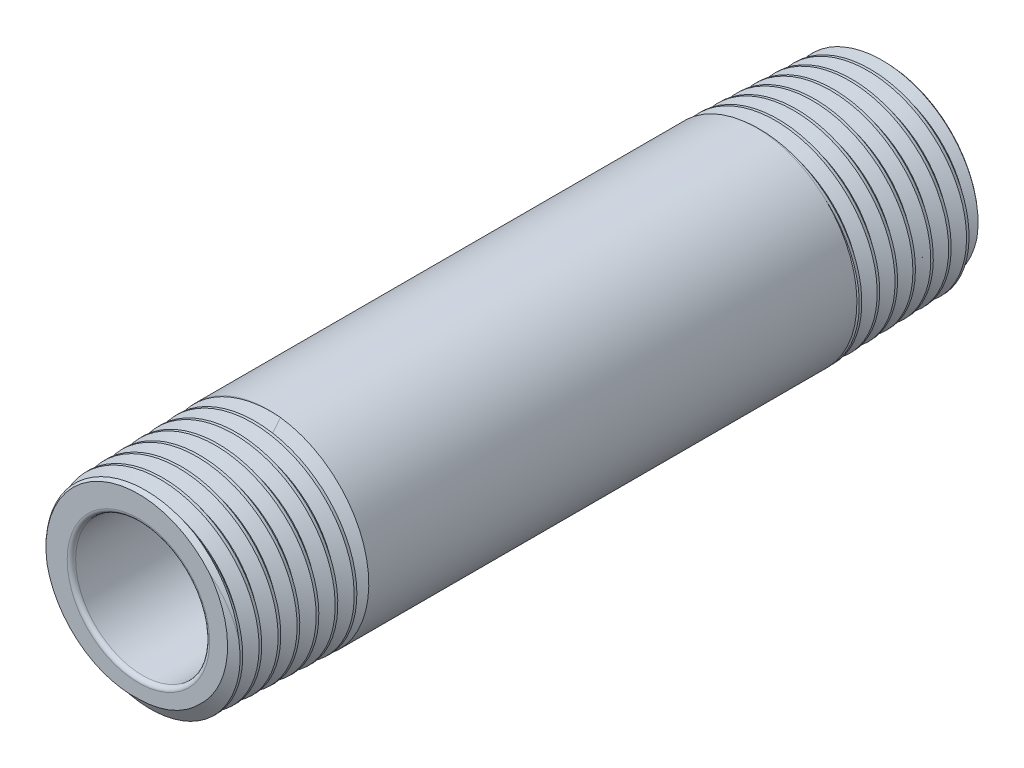
from build123d import *

# Parameters (mm, degrees)
CHAMFER1_SIZE       = 0.2159
CHAMFER1_SIZE2      = 0.22294606732244152
FILLET1_R           = 0.2159
SKETCH6_R           = 5.143500000000003
BOSS_EXTRUDE1_DEPTH = 6.604
BOSS_EXTRUDE1_TAPER = 60.000000000000135
SKETCH7_R           = 3.416299999999999
CUT_EXTRUDE1_DEPTH  = 21.39151025224469
CIRPATTERN1_COUNT   = 2


with BuildPart() as part:
    # Sketch3 → Revolve1 (revolve)
    with BuildSketch(Plane(origin=(0, 0, 0), x_dir=(0, 0, -1), z_dir=(1, 0, 0)), mode=Mode.PRIVATE) as revolve1_sk:
        Polygon((-19.049999999999997, 4.937883844480303), (-12.445999999999998, 5.143500000000026), (0, 5.143500000000033), (0, 3.416299999999999), (-19.049999999999997, 3.4162999999999966), align=None)
    revolve(revolve1_sk.sketch.rotate(Axis((0, 2.566e-14, 19.049999999999997), (0, 0, -1)), 90), axis=Axis((0, 2.566e-14, 19.049999999999997), (0, 0, -1)))

    # Chamfer1
    chamfer1_edges = [part.edges().sort_by_distance(p)[0] for p in [
        (-4.937883844480277, 2.451e-14, 19.049999999999997),
    ]]
    chamfer1_side = [part.faces().sort_by_distance(p)[0] for p in [
        (-5.040691922240139, 2.449e-14, 15.747999999999998),
    ]]
    chamfer(chamfer1_edges, length=CHAMFER1_SIZE, length2=CHAMFER1_SIZE2, reference=chamfer1_side[0])

    # Fillet1
    fillet1_edges = [part.edges().sort_by_distance(p)[0] for p in [
        (-3.416299999999971, 2.486e-14, 19.049999999999997),
    ]]
    fillet(fillet1_edges, radius=FILLET1_R)

    # Mirror1: part across plane


with BuildPart() as part_1:
    add(part.part)
    add(part.part.mirror(Plane.XY))

    # SurfaceCut1
    split(bisect_by=Plane.XY, keep=Keep.TOP)


with BuildPart() as body_2:
    # Split1: the piece on the far side of the plane
    add(part_1.part)
    split(bisect_by=Plane.XY.offset(12.445999999999998), keep=Keep.BOTTOM)


with BuildPart() as part_2:
    add(part_1.part)

    # Split1
    split(bisect_by=Plane.XY.offset(12.445999999999998), keep=Keep.TOP)

    # Cut-Sweep1: sweep along a curve in space
    with BuildLine() as cut_sweep1_path:
        add(Edge.make_bspline(
            [(-1.724e-14, 4.937883844480297, 19.049999999999997), (0.6479834024634948, 4.9384955793921845, 19.030352237654323), (1.2959562068442978, 4.809934846285584, 19.01070447530864), (2.493700065543902, 4.3137597166585575, 18.971408950617278), (3.042994402756142, 3.946340706793448, 18.951761188271604), (3.9591268792347645, 3.028337158977756, 18.912465663580246), (4.325599581977704, 2.4781160609167507, 18.892817901234565), (4.819696815521148, 1.2784716410989483, 18.853522376543214), (4.947123203730261, 0.6295243122559492, 18.833874614197534), (4.943249861633712, -0.6683639161122303, 18.794579089506172), (4.811949732972757, -1.3167890375944493, 18.774931327160495), (4.310328895597964, -2.514351520947074, 18.73563580246913), (3.940205740552795, -3.063012230766883, 18.715988040123456), (3.0172413047935445, -3.9768869433170755, 18.676692515432094), (2.464765440787788, -4.34173640138223, 18.657044753086417), (1.261404965161384, -4.8318438829556705, 18.617749228395066), (0.6109978302294494, -4.956905346490915, 18.59810146604938), (-0.688791747116143, -4.947920120672505, 18.55880594135802), (-1.3376576482970945, -4.813875064430212, 18.539158179012347), (-2.535014429222804, -4.3068023036928365, 18.49986265432099), (-3.083028731651889, -3.93397432237736, 18.480214891975308), (-3.9946208246623853, -3.006052595447282, 18.44091936728395), (-4.3578349723354535, -2.4513262419514277, 18.42127160493827), (-4.843931124589415, -1.2442625734004324, 18.38197608024691), (-4.9666181604179656, -0.5924042137085583, 18.362328317901234), (-4.952506058257749, 0.7092665494087685, 18.323032793209872), (-4.8157105908348266, 1.3585616564247005, 18.303385030864195), (-4.303179798311932, 2.5556883562747204, 18.26408950617284), (-3.927646368357448, 3.1030434562276152, 18.24444174382716), (-2.9947710658231097, 4.0123280676016995, 18.205146219135795), (-2.4377985593168003, 4.373894847772765, 18.18549845679012), (-1.2270446729304163, 4.855958132963638, 18.14620293209877), (-0.5737437219430983, 4.976261269038454, 18.126555169753082), (0.7297879753111253, 4.95700737756262, 18.087259645061724), (1.379500678039882, 4.817456063988477, 18.067611882716047), (2.576372867063742, 4.299461238757999, 18.028316358024693), (3.123055954632113, 3.9212217966252103, 18.008668595679012), (4.030008216337635, 2.9833967529530843, 17.969373070987654), (4.389915580786658, 2.4241824899391498, 17.949725308641973), (4.867924501325379, 1.2097514728986394, 17.910429783950622), (4.985834296848172, 0.5550166161046024, 17.890782021604934), (4.961423783192364, -0.7503556755375738, 17.851486496913576), (4.8191112373252585, -1.400474327802263, 17.831838734567903), (4.2956464862729735, -2.59706752561658, 17.792543209876545), (3.9147005273586846, -3.1430657763341334, 17.772895447530864), (2.971929696018746, -4.047660814954261, 17.733599922839506), (2.410478133020024, -4.405896724636701, 17.713952160493825), (1.1923831844830064, -4.879829823637146, 17.67465663580247), (0.5362231592826996, -4.9953368693209494, 17.655008873456786), (-0.7709692992017093, -4.965754981192314, 17.61571334876543), (-1.42148221897539, -4.820675865918678, 17.596065586419755), (-2.61777189503427, -4.2917354040431475, 17.556770061728393), (-3.1630724701423, -3.9080824827857614, 17.537122299382716), (-4.065285407426989, -2.960369936352574, 17.49782677469135), (-4.421837832759499, -2.3966855899074933, 17.478179012345677), (-4.89167369458659, -1.1749400208896585, 17.438883487654323), (-5.00476861291793, -0.5173636164814726, 17.41923572530864), (-4.970000679055924, 0.7916284938222706, 17.37994020061728), (-4.82214970648881, 1.4425239634336553, 17.360292438271607), (-4.287727857204288, 2.638485537500708, 17.320996913580245), (-3.9013675871881586, 3.1830755842142184, 17.301349151234568), (-2.9487175174394733, 4.082881537632398, 17.262053626543203), (-2.3828049640962297, 4.437738458778683, 17.242405864197526), (-1.1574221973504755, 4.9034557095961935, 17.20311033950618), (-0.49843825461570823, 5.014129155096828, 17.18346257716049), (0.8123329053291589, 4.974160585732752, 17.144167052469136), (1.4635991716692796, 4.823532517409431, 17.124519290123455), (2.659208014291241, 4.283623712846748, 17.0852237654321), (3.2030746660656804, 3.894555766905329, 17.06557600308642), (4.100448749358127, 2.9369724849181824, 17.026280478395062), (4.453598156514858, 2.368836361227666, 17.00663271604938), (4.915175464832906, 1.1398299311206526, 16.96733719135803), (5.023418124321186, 0.4794473425072056, 16.94768942901235), (4.978234411636441, -0.833082178069387, 16.908393904320985), (4.824824058715115, -1.484707452799352, 16.88874614197531), (4.279422840020476, -2.679938885781295, 16.849450617283946), (3.887646950338295, -3.22306926257988, 16.829802854938272), (2.9251348865825912, -4.1179865863127825, 16.79050733024691), (2.354779889089959, -4.469416479995621, 16.770859567901233), (1.1221634414760926, -4.926832557217814, 16.731564043209882), (0.4603911508809596, -5.0326351500695905, 16.711916280864195), (-0.853875954813153, -4.982221868652633, 16.672620756172844), (-1.5058484145728106, -4.826024092108318, 16.652972993827163), (-2.7006777114549543, -4.2751251097400855, 16.613677469135798), (-3.2430589200165834, -3.88064106795353, 16.594029706790124), (-4.135494592135794, -2.9132047723831316, 16.554734182098766), (-4.4851929834655, -2.3406356576180656, 16.535086419753085), (-4.938426584435778, -1.1044229497109015, 16.495790895061734), (-5.041779862844908, -0.4412699523613095, 16.47614313271605), (-4.986122670146919, 0.8747138767599391, 16.436847608024692), (-4.827132380966399, 1.5270216633776004, 16.417199845679015), (-4.270730394989775, 2.721424049913686, 16.37790432098765), (-3.873538052286691, 3.263043184021431, 16.358256558641976), (-2.901182194427972, 4.1529723104073675, 16.318961033950615), (-2.3264037788936145, 4.50092722139599, 16.299313271604937), (-1.0866086791346827, 4.949957144945079, 16.260017746913583), (-0.4220840214680713, 5.0508518941834835, 16.2403699845679), (0.895595583544624, 4.989936530972702, 16.20107445987654), (1.548226804247682, 4.828148690348668, 16.181426697530863), (2.742177458884932, 4.266238570728335, 16.142131172839505), (3.283021599635118, 3.866337837946425, 16.122483410493825), (4.170419284658331, 2.8890672069843424, 16.083187885802463), (4.516618748495482, 2.31208436714491, 16.06354012345679), (4.96142383798703, 1.0687208550699734, 16.024244598765435), (5.059850876664323, 0.4028336346126808, 16.00459683641975), (4.993663167479094, -0.9165207132435833, 15.965301311728398), (4.829072787003335, -1.5694634408702866, 15.945653549382717), (4.261649513893983, -2.762937495230911, 15.906358024691352), (3.8590403616180198, -3.3029937113027605, 15.886710262345678), (2.876859866479624, -4.187835058380133, 15.84741473765432), (2.2976775387466932, -4.532267119719317, 15.82776697530864), (1.050759704849418, -4.972826263595607, 15.788471450617289), (0.38351907009412417, -5.068776443918274, 15.768823688271604), (-0.9374889023809881, -4.997302297518728, 15.72952816358025), (-1.5907311755930338, -4.829904439374469, 15.70988040123457), (-2.7837037149572947, -4.256963103409261, 15.670584876543211), (-3.32295906288315, -3.851645562067084, 15.65093711419753), (-4.2052191750347285, -2.864560231502529, 15.611641589506174), (-4.547871890279748, -2.2831834122200023, 15.591993827160492), (-4.984164022607058, -1.0327254578130656, 15.552698302469135), (-5.077628230637193, -0.36414060809498533, 15.533050540123455), (-5.000853640455587, 0.9584997859349876, 15.493755015432098), (-4.830643417608928, 1.612029609431176, 15.474107253086416), (-4.252179220185848, 2.804475673221989, 15.43481172839506), (-3.8441533801432164, 3.3429171976580383, 15.41516396604938), (-2.85216836280425, 4.222571178064509, 15.375868441358021), (-2.2686021082319927, 4.563432615655921, 15.356220679012344), (-1.014618345305617, 4.995436716669484, 15.316925154320984), (-0.344698530677452, 5.0864058725830725, 15.297277391975308), (0.9795529973439306, 5.004316917172806, 15.25798186728395), (1.6333583420747773, 4.831289493563263, 15.23833410493827), (2.825252924343863, 4.247297747129387, 15.199038580246917), (3.3628676583415515, 3.836563758783516, 15.179390817901234), (4.239890610902287, 2.8396843232994136, 15.140095293209875), (4.578948851603917, 2.253933749595567, 15.1204475308642), (5.006643948252462, 0.9964386006734746, 15.08115200617284), (5.095109006597185, 0.32519312177911697, 15.06150424382716), (5.0076918500804135, -1.0006481685127746, 15.022208719135802), (4.831842440810549, -1.6547169718960992, 15.002560956790125), (4.242318569144174, -2.846035021811639, 14.963265432098767), (3.828876643016173, -3.3828099870895003, 14.943617669753086), (2.827108178067148, -4.257177016981221, 14.904322145061727), (2.2391784612691006, -4.594420154166729, 14.88467438271605), (0.9781864592619042, -5.017785320656595, 14.845378858024691), (0.30562466720889814, -5.10373727060919, 14.82573109567901), (-1.0217849298193837, -5.010978163123082, 14.786435570987651), (-1.6761050959568649, -4.832302034647226, 14.766787808641974), (-2.8668215182926757, -4.237241573137894, 14.72749228395062), (-3.4027437255087736, -3.8210919799639425, 14.707844521604937), (-4.2744299397448104, -2.8144399943520226, 14.66854899691358), (-4.609846079684246, -2.2243363703561254, 14.648901234567901), (-5.028860438023093, -0.9598621584121545, 14.609605709876544), (-5.112290303646229, -0.28599345464291737, 14.589957947530861), (-5.014175581787844, 1.0429629101208588, 14.550662422839505), (-4.8326680520999235, 1.6975223100155539, 14.53101466049383), (-4.232066648026328, 2.887611965641789, 14.491719135802471), (-3.8132097188476517, 3.4226684146666897, 14.472071373456785), (-2.801679841565012, 4.2916489226568, 14.432775848765429), (-2.2094076061048256, 4.625226184803297, 14.413128086419752), (-0.9414659374583672, 5.039868905343335, 14.373832561728396), (-0.2662997736201707, 5.120767745842014, 14.354184799382711), (1.0641817367600617, 5.017283833111765, 14.314889274691357), (1.7189682085348887, 4.832940271932183, 14.29524151234568), (2.908405914910209, 4.2267936847379275, 14.25594598765432), (3.4425835951004813, 3.805229810989547, 14.236298225308637), (4.308833509211241, 2.78882779128429, 14.197002700617285), (4.6405600264876385, 2.1943922999076197, 14.177354938271607), (5.050810328468426, 0.92299803772461, 14.138059413580248), (5.1291692384458845, 0.24654391553834132, 14.118411651234565), (5.020302645689612, -1.0854410355720012, 14.079116126543209), (4.833118474651225, -1.740442384689195, 14.05946836419753), (4.2214225762184325, -2.9292029163544435, 14.02017283950617), (3.7971522098167183, -3.4624888068266872, 14.000525077160491), (2.7758839172561105, -4.325983242942424, 13.961229552469131), (2.179290585300722, -4.6558471620279365, 13.941581790123458), (0.9044587025218613, -5.061684314118704, 13.9022862654321), (0.2267261736494774, -5.137494423831862, 13.882638503086417), (-1.1067404308903488, -5.023231749681475, 13.843342978395059), (-1.7619444303718013, -4.833202442514659, 13.823695216049384), (-2.950002519445155, -4.2159532174354695, 13.784399691358024), (-3.4823835893506296, -3.788976870864395, 13.764751929012343), (-4.3430976674349, -2.7628482953955387, 13.725456404320985), (-4.6710871490518215, -2.1641025979634794, 13.70580864197531), (-5.072490469893311, -0.8858481771447881, 13.66651311728395), (-5.145742945507685, -0.20684684305560724, 13.646865354938269), (-5.026070876820374, 1.1280795455540011, 13.607569830246911), (-4.833191959537128, 1.783473936202618, 13.587922067901236), (-4.210385505382988, 2.9708042728762063, 13.54862654320988), (-3.780703751779336, 3.502267481675788, 13.528978780864197), (-2.7497210037873256, 4.360176326333416, 13.489683256172842), (-2.14882847571786, 4.686279545533863, 13.470035493827162), (-0.8671667088686656, 5.083228404279672, 13.430739969135804), (-0.1869062207044988, 5.1539144481238095, 13.411092206790121), (1.149458000913506, 5.028819760419864, 13.371796682098765), (1.8050304915355837, 4.833086811496976, 13.352148919753088), (2.9916077245735675, 4.204719339085805, 13.31285339506173), (3.5221400223134385, 3.7723328123229334, 13.293205632716049), (4.377218763353007, 2.7365021226864017, 13.253910108024685), (4.701423909805591, 2.133468358527786, 13.234262345679014), (5.093897726663025, 0.8484145469461539, 13.194966820987656), (5.162008577482427, 0.16690460538500904, 13.175319058641975), (5.031478135381537, -1.1708754168378805, 13.136023533950617), (4.832886785942842, -1.8266136844662277, 13.11637577160494), (4.198954619604006, -3.0124124217043278, 13.077080246913582), (3.7638640143745232, -3.542000749292053, 13.0574324845679), (2.723191734518647, -4.394224522288958, 13.018136959876543), (2.1180223884984217, -4.716519800565512, 12.998489197530866), (0.8295919426040201, -5.104498047335914, 12.959193672839508), (0.14684229772275564, -5.170024980546429, 12.939545910493827), (-1.192331411721108, -5.03404573820258, 12.900250385802469), (-1.8482231018392825, -4.832591672200238, 12.880602623456788), (-3.0332179106857495, -4.193091250037344, 12.841307098765435), (-3.561849200166853, -3.7552973219345183, 12.821659336419753), (-4.411193147026837, -2.709789923881475, 12.782363811728395), (-4.731566776889069, -2.102490709875576, 12.762716049382716), (-5.115028977507638, -0.8106991490399917, 12.72342052469136), (-5.177963305448383, -0.12671960017556644, 12.703772762345679), (-5.036522306983252, 1.2138256024888492, 12.664477237654319), (-4.832201261378136, 1.8698583292561528, 12.644829475308642), (-4.187129135529673, 3.0540237371941865, 12.605533950617286), (-3.7466327011275444, 3.5816849120293432, 12.585886188271605), (-2.6962967775443714, 4.428124181552494, 12.546590663580243), (-2.0868734690447273, 4.746564398238731, 12.526942901234566), (-0.7917364214192102, 5.12549012931377, 12.487647376543212), (-0.10653681702892127, 5.185823201499467, 12.467999614197531), (1.2353576046051575, 5.03890758143436, 12.428704089506173), (1.8915189510827712, 4.831715346375406, 12.409056327160494), (3.074829446174329, 4.1810681832731476, 12.369760802469136), (3.6015074215168745, 3.7378701202055127, 12.350113040123457), (4.445017169962126, 2.682712384449418, 12.310817515432097), (4.761512224473951, 2.071170814530332, 12.291169753086418), (5.135881115825587, 0.772704016870994, 12.251874228395062), (5.19360431919841, 0.0862942543913167, 12.23222646604938), (5.041201302884692, -1.2569270320792585, 12.192930941358023), (4.831133721887346, -1.9132045504571245, 12.173283179012342), (4.174908302512577, -3.0956345818481665, 12.13398765432099), (3.7290095495506344, -3.621316264822238, 12.114339891975307), (2.669036835711721, -4.461871656472305, 12.07504436728395), (2.0553828969949297, -4.776409815861181, 12.05539660493827), (0.7536021944853867, -5.146201551059515, 12.016101080246914), (0.06599222018976941, -5.20130631024039, 11.996453317901233), (-1.278533497472196, -5.04340321428845, 11.957157793209879), (-1.934914709297002, -4.830456184412123, 11.937510030864196), (-3.116438687724137, -4.1686494045496545, 11.89821450617284), (-3.6411109777031565, -3.7200509616785307, 11.87856674382716), (-4.478687185429947, -2.655270224619957, 11.839271219135798), (-4.79125673308388, -2.0395098692382243, 11.819623456790122), (-5.156451049986573, -0.7344312153096861, 11.78032793209877), (-5.208928827525938, -0.04563102416491559, 11.760680169753085), (-5.045513060232592, 1.3001766119038625, 11.72138464506173), (-4.829682532257184, 1.956649008307733, 11.70173688271605), (-4.16229140274716, 3.1372413066062528, 11.662441358024688), (-3.7109943312410194, 3.660891095492044, 11.642793595679011), (-2.641412646636564, 4.495463301322478, 11.60349807098765), (-2.023551886196134, 4.806052537252532, 11.583850308641974), (-0.715191342344941, 5.166629228541791, 11.544554783950614), (-0.02521097786643024, 5.2164715251698, 11.524907021604937), (0.6483225035966717, 5.132001056057006, 11.505259259259256)],
            knots=[0, 0, 0, 0, 0.0078125, 0.0078125, 0.015625, 0.015625, 0.0234375, 0.0234375, 0.03125, 0.03125, 0.0390625, 0.0390625, 0.046875, 0.046875, 0.0546875, 0.0546875, 0.0625, 0.0625, 0.0703125, 0.0703125, 0.078125, 0.078125, 0.0859375, 0.0859375, 0.09375, 0.09375, 0.1015625, 0.1015625, 0.109375, 0.109375, 0.1171875, 0.1171875, 0.125, 0.125, 0.1328125, 0.1328125, 0.140625, 0.140625, 0.1484375, 0.1484375, 0.15625, 0.15625, 0.1640625, 0.1640625, 0.171875, 0.171875, 0.1796875, 0.1796875, 0.1875, 0.1875, 0.1953125, 0.1953125, 0.203125, 0.203125, 0.2109375, 0.2109375, 0.21875, 0.21875, 0.2265625, 0.2265625, 0.234375, 0.234375, 0.2421875, 0.2421875, 0.25, 0.25, 0.2578125, 0.2578125, 0.265625, 0.265625, 0.2734375, 0.2734375, 0.28125, 0.28125, 0.2890625, 0.2890625, 0.296875, 0.296875, 0.3046875, 0.3046875, 0.3125, 0.3125, 0.3203125, 0.3203125, 0.328125, 0.328125, 0.3359375, 0.3359375, 0.34375, 0.34375, 0.3515625, 0.3515625, 0.359375, 0.359375, 0.3671875, 0.3671875, 0.375, 0.375, 0.3828125, 0.3828125, 0.390625, 0.390625, 0.3984375, 0.3984375, 0.40625, 0.40625, 0.4140625, 0.4140625, 0.421875, 0.421875, 0.4296875, 0.4296875, 0.4375, 0.4375, 0.4453125, 0.4453125, 0.453125, 0.453125, 0.4609375, 0.4609375, 0.46875, 0.46875, 0.4765625, 0.4765625, 0.484375, 0.484375, 0.4921875, 0.4921875, 0.5, 0.5, 0.5078125, 0.5078125, 0.515625, 0.515625, 0.5234375, 0.5234375, 0.53125, 0.53125, 0.5390625, 0.5390625, 0.546875, 0.546875, 0.5546875, 0.5546875, 0.5625, 0.5625, 0.5703125, 0.5703125, 0.578125, 0.578125, 0.5859375, 0.5859375, 0.59375, 0.59375, 0.6015625, 0.6015625, 0.609375, 0.609375, 0.6171875, 0.6171875, 0.625, 0.625, 0.6328125, 0.6328125, 0.640625, 0.640625, 0.6484375, 0.6484375, 0.65625, 0.65625, 0.6640625, 0.6640625, 0.671875, 0.671875, 0.6796875, 0.6796875, 0.6875, 0.6875, 0.6953125, 0.6953125, 0.703125, 0.703125, 0.7109375, 0.7109375, 0.71875, 0.71875, 0.7265625, 0.7265625, 0.734375, 0.734375, 0.7421875, 0.7421875, 0.75, 0.75, 0.7578125, 0.7578125, 0.765625, 0.765625, 0.7734375, 0.7734375, 0.78125, 0.78125, 0.7890625, 0.7890625, 0.796875, 0.796875, 0.8046875, 0.8046875, 0.8125, 0.8125, 0.8203125, 0.8203125, 0.828125, 0.828125, 0.8359375, 0.8359375, 0.84375, 0.84375, 0.8515625, 0.8515625, 0.859375, 0.859375, 0.8671875, 0.8671875, 0.875, 0.875, 0.8828125, 0.8828125, 0.890625, 0.890625, 0.8984375, 0.8984375, 0.90625, 0.90625, 0.9140625, 0.9140625, 0.921875, 0.921875, 0.9296875, 0.9296875, 0.9375, 0.9375, 0.9453125, 0.9453125, 0.953125, 0.953125, 0.9609375, 0.9609375, 0.96875, 0.96875, 0.9765625, 0.9765625, 0.984375, 0.984375, 0.9921875, 0.9921875, 1, 1, 1, 1], degree=3))
    # Sketch4 → Cut-Sweep1 (sweep, cut)
    with BuildSketch(Plane(origin=(0, 0, 0), x_dir=(0, 0, -1), z_dir=(1, 0, 0))):
        Polygon((-19.52037037037037, 4.326854809587937), (-19.402777777777782, 4.326854809587937), (-18.991203703703704, 5.039722016962357), (-19.9025462962963, 4.98880293072133), align=None)
    sweep(path=cut_sweep1_path.line, is_frenet=True, mode=Mode.SUBTRACT)

    add(body_2.part)  # Boss-Extrude1 merges body 2
    # Sketch6 → Boss-Extrude1 (add, through all)
    with BuildSketch(Plane.XY.offset(12.445999999999998)):
        Circle(SKETCH6_R)
    extrude(amount=BOSS_EXTRUDE1_DEPTH, taper=BOSS_EXTRUDE1_TAPER)

    # Sketch7 → Cut-Extrude1 (cut, through all)
    with BuildSketch(Plane.XY):
        Circle(SKETCH7_R)
    extrude(amount=CUT_EXTRUDE1_DEPTH, mode=Mode.SUBTRACT)


with BuildPart() as cirpattern1_1:
    # CirPattern1: pattern copy
    add(part_2.part.rotate(Axis((0, 5.143500000000033, 0), (0, -1, 0)), 1 * 360 / CIRPATTERN1_COUNT))

    # Combine2: union part
    add(part_2.part)


solid = cirpattern1_1.part
